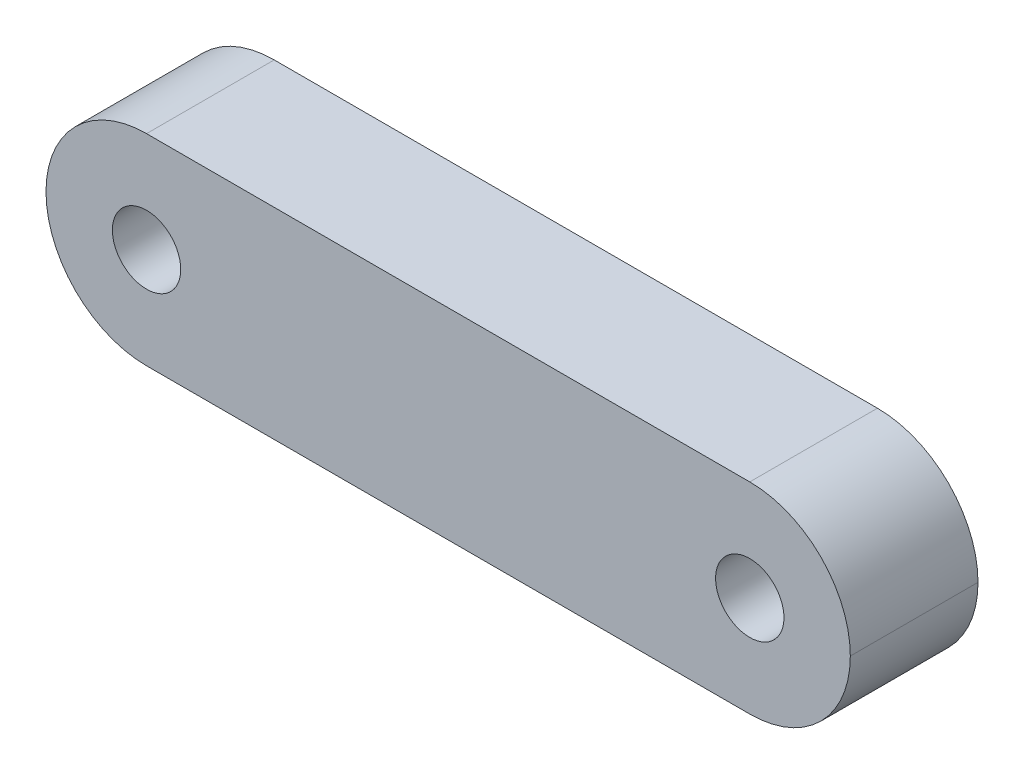
from build123d import *

# Parameters (mm, degrees)
SKETCH1_W           = 40
SKETCH1_H           = 10
SKETCH1_R           = 1.7
BOSS_EXTRUDE1_DEPTH = 6.35
FILLET1_R           = 5


with BuildPart() as part:
    # Sketch1 → Boss-Extrude1 (new body)
    with BuildSketch(Plane.XY):
        with Locations((20, 5)):
            Rectangle(SKETCH1_W, SKETCH1_H)
        with Locations((35, 5)):
            Circle(SKETCH1_R, mode=Mode.SUBTRACT)
        with Locations((5, 5)):
            Circle(SKETCH1_R, mode=Mode.SUBTRACT)
    extrude(amount=BOSS_EXTRUDE1_DEPTH)

    # Fillet1
    fillet1_edges = [part.edges().sort_by_distance(p)[0] for p in [
        (0, 10, 3.175),
        (0, 0, 3.175),
        (40, 10, 3.175),
        (40, 0, 3.175),
    ]]
    fillet(fillet1_edges, radius=FILLET1_R - 0.0001)  # a hair under: the kernel refuses the full size


solid = part.part
